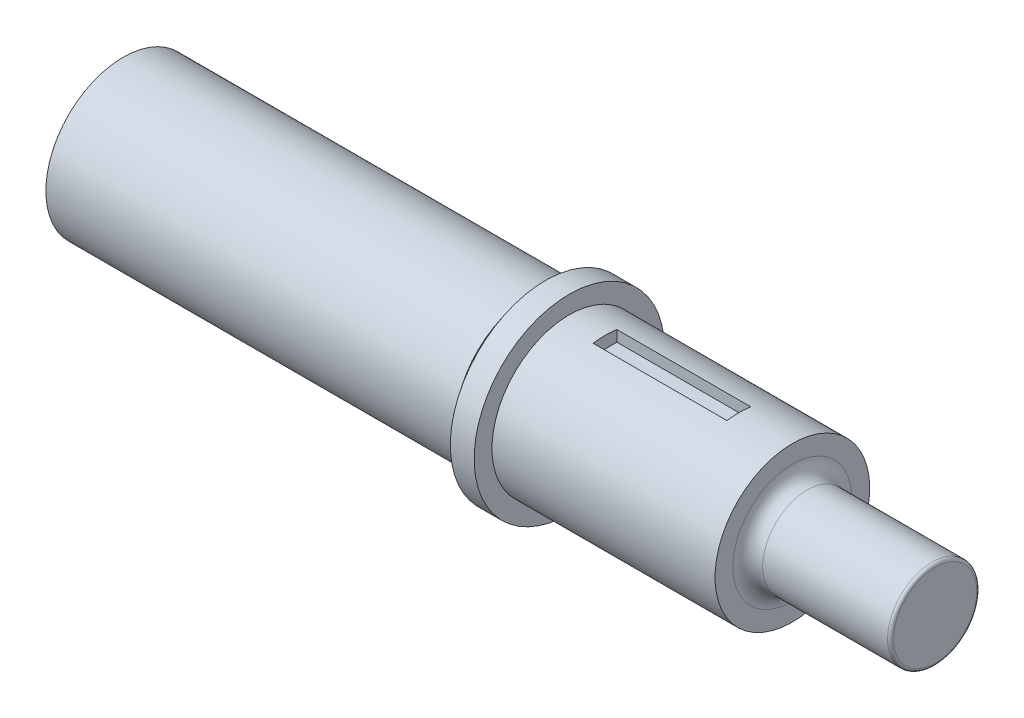
from build123d import *

# Parameters (mm, degrees)
SKETCH1_R                                = 26
BOSS_EXTRUDE1_DEPTH                      = 137.5
SKETCH2_R                                = 22
BOSS_EXTRUDE2_DEPTH                      = 4.5
SKETCH3_R                                = 32
BOSS_EXTRUDE3_DEPTH                      = 8
SKETCH4_R                                = 26
BOSS_EXTRUDE4_DEPTH                      = 75
F_12_0_12_DIAMETER_HOLE1_D               = 12
F_12_0_12_DIAMETER_HOLE1_DEPTH           = 20
F_12_0_12_DIAMETER_HOLE1_TIP             = 3.605163714
F_12_0_12_DIAMETER_HOLE1_ON_FACE_2_D     = 12
F_12_0_12_DIAMETER_HOLE1_ON_FACE_2_DEPTH = 20
F_12_0_12_DIAMETER_HOLE1_ON_FACE_2_TIP   = 3.605163714
SKETCH6_R                                = 15
BOSS_EXTRUDE5_DEPTH                      = 48
FILLET2_R                                = 5
CUT_EXTRUDE1_START                       = 26
SKETCH7_W                                = 45
SKETCH7_H                                = 8
CUT_EXTRUDE1_DEPTH                       = 4
M8_CLEARANCE_HOLE1_D                     = 8.4
M8_CLEARANCE_HOLE1_DEPTH                 = 13
M8_CLEARANCE_HOLE1_TIP                   = 2.5236146
FILLET3_R                                = 1


with BuildPart() as part:
    # Sketch1 → Boss-Extrude1 (new body)
    with BuildSketch(Plane(origin=(0, 0, 0), x_dir=(0, 0, -1), z_dir=(1, 0, 0))):
        Circle(SKETCH1_R)
    extrude(amount=BOSS_EXTRUDE1_DEPTH)

    # Sketch2 → Boss-Extrude2 (add)
    with BuildSketch(Plane(origin=(137.5, 0, 0), x_dir=(0, 0, -1), z_dir=(1, 0, 0))):
        Circle(SKETCH2_R)
    extrude(amount=BOSS_EXTRUDE2_DEPTH)

    # Sketch3 → Boss-Extrude3 (add)
    with BuildSketch(Plane(origin=(142, 0, 0), x_dir=(0, 0, -1), z_dir=(1, 0, 0))):
        Circle(SKETCH3_R)
    extrude(amount=BOSS_EXTRUDE3_DEPTH)

    # Sketch4 → Boss-Extrude4 (add)
    with BuildSketch(Plane(origin=(150, 0, 0), x_dir=(0, 0, -1), z_dir=(1, 0, 0))):
        Circle(SKETCH4_R)
    extrude(amount=BOSS_EXTRUDE4_DEPTH)

    # Ø12.0 (12) Diameter Hole1
    with Locations(Plane(origin=(0, 0, 0), x_dir=(0, 0, -1), z_dir=(-1, 0, 0))):
        with Locations((0, 0)):
            Hole(F_12_0_12_DIAMETER_HOLE1_D / 2, depth=F_12_0_12_DIAMETER_HOLE1_DEPTH)
            with Locations((0, 0, -(F_12_0_12_DIAMETER_HOLE1_DEPTH + F_12_0_12_DIAMETER_HOLE1_TIP / 2))):  # 118° drill point
                Cone(0, F_12_0_12_DIAMETER_HOLE1_D / 2, F_12_0_12_DIAMETER_HOLE1_TIP, mode=Mode.SUBTRACT)

    # Ø12.0 (12) Diameter Hole1 on face 2
    with Locations(Plane(origin=(-153.563701333, 12.350945858, 0), x_dir=(0, 0, -1), z_dir=(-1, 0, 0))):
        with Locations((0, 0)):
            Hole(F_12_0_12_DIAMETER_HOLE1_ON_FACE_2_D / 2, depth=F_12_0_12_DIAMETER_HOLE1_ON_FACE_2_DEPTH)
            with Locations((0, 0, -(F_12_0_12_DIAMETER_HOLE1_ON_FACE_2_DEPTH + F_12_0_12_DIAMETER_HOLE1_ON_FACE_2_TIP / 2))):  # 118° drill point
                Cone(0, F_12_0_12_DIAMETER_HOLE1_ON_FACE_2_D / 2, F_12_0_12_DIAMETER_HOLE1_ON_FACE_2_TIP, mode=Mode.SUBTRACT)

    # Sketch6 → Boss-Extrude5 (add)
    with BuildSketch(Plane(origin=(225, 0, 0), x_dir=(0, 0, -1), z_dir=(1, 0, 0))):
        Circle(SKETCH6_R)
    extrude(amount=BOSS_EXTRUDE5_DEPTH)

    # Fillet2
    fillet2_edges = [part.edges().sort_by_distance(p)[0] for p in [
        (225, 0, 15),
    ]]
    fillet(fillet2_edges, radius=FILLET2_R)

    # Sketch7 → Cut-Extrude1 (cut)
    with BuildSketch(Plane(origin=(0, 0, 0), x_dir=(1, 0, 0), z_dir=(0, 1, 0)).offset(CUT_EXTRUDE1_START)):
        with Locations((184.5, 0)):
            Rectangle(SKETCH7_W, SKETCH7_H)
    extrude(amount=-CUT_EXTRUDE1_DEPTH, mode=Mode.SUBTRACT)

    # M8 Clearance Hole1
    with Locations(Plane.ZY):
        with Locations((0, -16)):
            Hole(M8_CLEARANCE_HOLE1_D / 2, depth=M8_CLEARANCE_HOLE1_DEPTH)
            with Locations((0, 0, -(M8_CLEARANCE_HOLE1_DEPTH + M8_CLEARANCE_HOLE1_TIP / 2))):  # 118° drill point
                Cone(0, M8_CLEARANCE_HOLE1_D / 2, M8_CLEARANCE_HOLE1_TIP, mode=Mode.SUBTRACT)

    # Fillet3
    fillet3_edges = [part.edges().sort_by_distance(p)[0] for p in [
        (273, 0, 15),
    ]]
    fillet(fillet3_edges, radius=FILLET3_R)


solid = part.part
